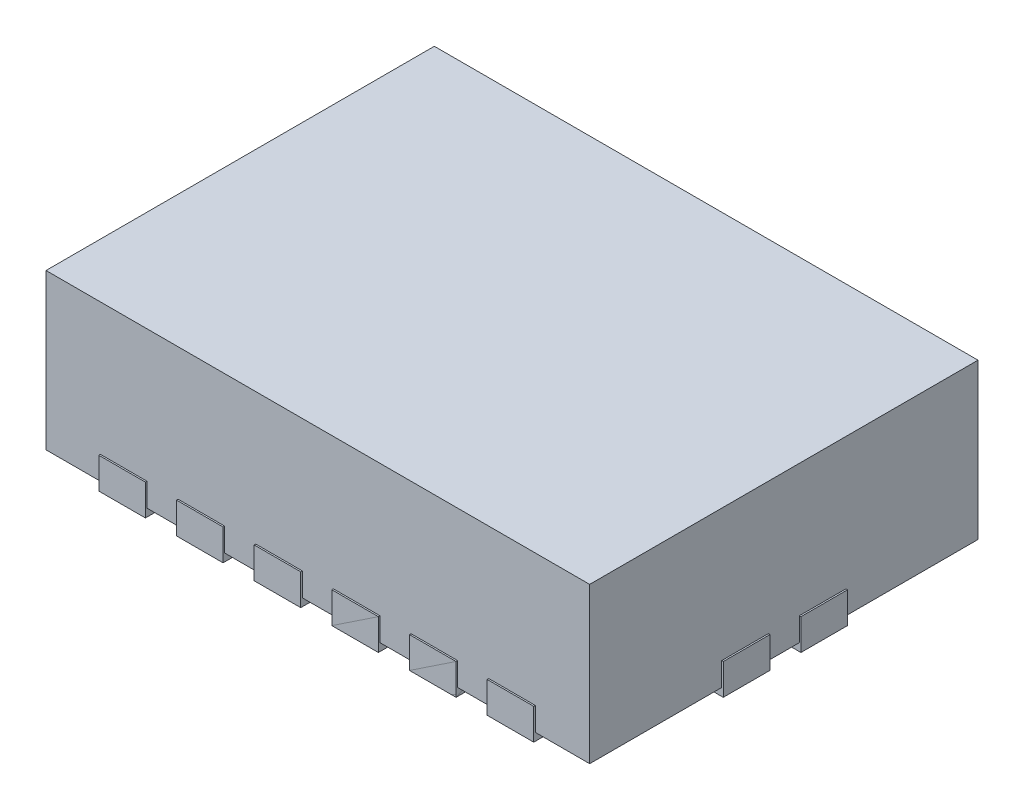
from build123d import *

# Parameters (mm, degrees)
SKETCH1_W            = 3.5
SKETCH1_H            = 2.5
BOSS_EXTRUDE1_DEPTH  = 1
BOSS_EXTRUDE2_START  = 0.05
BOSS_EXTRUDE2_DEPTH  = 0.2
LPATTERN1_START      = -0.05
LPATTERN1_DEPTH      = 0.2
LPATTERN1_2_DEPTH    = 0.2
LPATTERN1_3_DEPTH    = 0.2
LPATTERN1_4_DEPTH    = 0.2
LPATTERN1_5_DEPTH    = 0.2
LPATTERN1_6_DEPTH    = 0.2
LPATTERN1_7_DEPTH    = 0.2
LPATTERN1_8_DEPTH    = 0.2
LPATTERN1_9_DEPTH    = 0.2
LPATTERN1_10_DEPTH   = 0.2
LPATTERN1_11_DEPTH   = 0.2
BOSS_EXTRUDE3_START  = 0.05
BOSS_EXTRUDE3_DEPTH  = 0.2
LPATTERN2_START      = -0.05
LPATTERN2_DEPTH      = 0.2
LPATTERN2_2_DEPTH    = 0.2
LPATTERN2_3_DEPTH    = 0.2
LPATTERN2_4_DEPTH    = 0.2
LPATTERN2_5_DEPTH    = 0.2
LPATTERN2_6_DEPTH    = 0.2
LPATTERN2_7_DEPTH    = 0.2
LPATTERN2_8_DEPTH    = 0.2
LPATTERN2_9_DEPTH    = 0.2
LPATTERN2_10_DEPTH   = 0.2
LPATTERN2_11_DEPTH   = 0.2
BOSS_EXTRUDE4_START  = 0.05
BOSS_EXTRUDE4_DEPTH  = 0.2
LPATTERN3_COUNT      = 2
LPATTERN3_PITCH      = 0.5
MIRROR7_START        = 0.05
MIRROR7_COPY_1_DEPTH = 0.2


# Read off the part's stored shape, not the designer's step: LPattern1, LPattern2
with BuildPart() as part:
    # Sketch1 → Boss-Extrude1 (new body)
    with BuildSketch(Plane(origin=(0, 0, 0), x_dir=(1, 0, 0), z_dir=(0, 1, 0))):
        with Locations((1.75, 1.25)):
            Rectangle(SKETCH1_W, SKETCH1_H)
    extrude(amount=BOSS_EXTRUDE1_DEPTH)


with BuildPart() as body_2:
    # Sketch2 → Boss-Extrude2 (new body)
    with BuildSketch(Plane.XZ.offset(BOSS_EXTRUDE2_START)):
        with BuildLine():
            Line((2.15, 0.01), (2.15, -0.4))
            ThreePointArc((2.15, -0.4), (2, -0.5), (1.85, -0.4))
            Line((1.85, -0.4), (1.85, 0.01))
            Line((1.85, 0.01), (2.15, 0.01))
        make_face()
    extrude(amount=-BOSS_EXTRUDE2_DEPTH)


with BuildPart() as body_3:
    # LPattern1 outline → LPattern1 (new body)
    with BuildSketch(Plane(origin=(0, 0, 0), x_dir=(1, 0, 0), z_dir=(0, 1, 0)).offset(LPATTERN1_START)):
        with BuildLine():
            ThreePointArc((1.65, 0.4), (1.5, 0.5), (1.35, 0.4))
            Line((1.35, 0.4), (1.35, -0.01))
            Line((1.35, -0.01), (1.65, -0.01))
            Line((1.65, -0.01), (1.65, 0.4))
        make_face()
    extrude(amount=LPATTERN1_DEPTH)


with BuildPart() as body_4:
    # LPattern1 2 outline → LPattern1 2 (new body)
    with BuildSketch(Plane(origin=(0, 0, 0), x_dir=(1, 0, 0), z_dir=(0, 1, 0)).offset(LPATTERN1_START)):
        with BuildLine():
            ThreePointArc((2.65, 0.4), (2.5, 0.5), (2.35, 0.4))
            Line((2.35, 0.4), (2.35, -0.01))
            Line((2.35, -0.01), (2.65, -0.01))
            Line((2.65, -0.01), (2.65, 0.4))
        make_face()
    extrude(amount=LPATTERN1_2_DEPTH)


with BuildPart() as body_5:
    # LPattern1 3 outline → LPattern1 3 (new body)
    with BuildSketch(Plane(origin=(0, 0, 0), x_dir=(1, 0, 0), z_dir=(0, 1, 0)).offset(LPATTERN1_START)):
        with BuildLine():
            ThreePointArc((3.15, 0.4), (3, 0.5), (2.85, 0.4))
            Line((2.85, 0.4), (2.85, -0.01))
            Line((2.85, -0.01), (3.15, -0.01))
            Line((3.15, -0.01), (3.15, 0.4))
        make_face()
    extrude(amount=LPATTERN1_3_DEPTH)


with BuildPart() as body_6:
    # LPattern1 4 outline → LPattern1 4 (new body)
    with BuildSketch(Plane(origin=(0, 0, 0), x_dir=(1, 0, 0), z_dir=(0, 1, 0)).offset(LPATTERN1_START)):
        with BuildLine():
            ThreePointArc((1.15, 0.4), (1, 0.5), (0.85, 0.4))
            Line((0.85, 0.4), (0.85, -0.01))
            Line((0.85, -0.01), (1.15, -0.01))
            Line((1.15, -0.01), (1.15, 0.4))
        make_face()
    extrude(amount=LPATTERN1_4_DEPTH)


with BuildPart() as body_7:
    # LPattern1 5 outline → LPattern1 5 (new body)
    with BuildSketch(Plane(origin=(0, 0, 0), x_dir=(1, 0, 0), z_dir=(0, 1, 0)).offset(LPATTERN1_START)):
        with BuildLine():
            ThreePointArc((1.65, 0.4), (1.5, 0.5), (1.35, 0.4))
            Line((1.35, 0.4), (1.35, -0.01))
            Line((1.35, -0.01), (1.65, -0.01))
            Line((1.65, -0.01), (1.65, 0.4))
        make_face()
    extrude(amount=LPATTERN1_5_DEPTH)


with BuildPart() as body_8:
    # LPattern1 6 outline → LPattern1 6 (new body)
    with BuildSketch(Plane(origin=(0, 0, 0), x_dir=(1, 0, 0), z_dir=(0, 1, 0)).offset(LPATTERN1_START)):
        with BuildLine():
            ThreePointArc((2.15, 0.4), (2, 0.5), (1.85, 0.4))
            Line((1.85, 0.4), (1.85, -0.01))
            Line((1.85, -0.01), (2.15, -0.01))
            Line((2.15, -0.01), (2.15, 0.4))
        make_face()
    extrude(amount=LPATTERN1_6_DEPTH)


with BuildPart() as body_9:
    # LPattern1 7 outline → LPattern1 7 (new body)
    with BuildSketch(Plane(origin=(0, 0, 0), x_dir=(1, 0, 0), z_dir=(0, 1, 0)).offset(LPATTERN1_START)):
        with BuildLine():
            ThreePointArc((2.65, 0.4), (2.5, 0.5), (2.35, 0.4))
            Line((2.35, 0.4), (2.35, -0.01))
            Line((2.35, -0.01), (2.65, -0.01))
            Line((2.65, -0.01), (2.65, 0.4))
        make_face()
    extrude(amount=LPATTERN1_7_DEPTH)


with BuildPart() as body_10:
    # LPattern1 8 outline → LPattern1 8 (new body)
    with BuildSketch(Plane(origin=(0, 0, 0), x_dir=(1, 0, 0), z_dir=(0, 1, 0)).offset(LPATTERN1_START)):
        with BuildLine():
            ThreePointArc((0.65, 0.4), (0.5, 0.5), (0.35, 0.4))
            Line((0.35, 0.4), (0.35, -0.01))
            Line((0.35, -0.01), (0.65, -0.01))
            Line((0.65, -0.01), (0.65, 0.4))
        make_face()
    extrude(amount=LPATTERN1_8_DEPTH)


with BuildPart() as body_11:
    # LPattern1 9 outline → LPattern1 9 (new body)
    with BuildSketch(Plane(origin=(0, 0, 0), x_dir=(1, 0, 0), z_dir=(0, 1, 0)).offset(LPATTERN1_START)):
        with BuildLine():
            ThreePointArc((1.15, 0.4), (1, 0.5), (0.85, 0.4))
            Line((0.85, 0.4), (0.85, -0.01))
            Line((0.85, -0.01), (1.15, -0.01))
            Line((1.15, -0.01), (1.15, 0.4))
        make_face()
    extrude(amount=LPATTERN1_9_DEPTH)


with BuildPart() as body_12:
    # LPattern1 10 outline → LPattern1 10 (new body)
    with BuildSketch(Plane(origin=(0, 0, 0), x_dir=(1, 0, 0), z_dir=(0, 1, 0)).offset(LPATTERN1_START)):
        with BuildLine():
            ThreePointArc((1.65, 0.4), (1.5, 0.5), (1.35, 0.4))
            Line((1.35, 0.4), (1.35, -0.01))
            Line((1.35, -0.01), (1.65, -0.01))
            Line((1.65, -0.01), (1.65, 0.4))
        make_face()
    extrude(amount=LPATTERN1_10_DEPTH)


with BuildPart() as body_13:
    # LPattern1 11 outline → LPattern1 11 (new body)
    with BuildSketch(Plane(origin=(0, 0, 0), x_dir=(1, 0, 0), z_dir=(0, 1, 0)).offset(LPATTERN1_START)):
        with BuildLine():
            ThreePointArc((2.15, 0.4), (2, 0.5), (1.85, 0.4))
            Line((1.85, 0.4), (1.85, -0.01))
            Line((1.85, -0.01), (2.15, -0.01))
            Line((2.15, -0.01), (2.15, 0.4))
        make_face()
    extrude(amount=LPATTERN1_11_DEPTH)


with BuildPart() as body_14:
    # Sketch4 → Boss-Extrude3 (new body)
    with BuildSketch(Plane.XZ.offset(BOSS_EXTRUDE3_START)):
        with BuildLine():
            Line((1.35, -2.51), (1.35, -2.1))
            ThreePointArc((1.35, -2.1), (1.5, -2), (1.65, -2.1))
            Line((1.65, -2.1), (1.65, -2.51))
            Line((1.65, -2.51), (1.35, -2.51))
        make_face()
    extrude(amount=-BOSS_EXTRUDE3_DEPTH)


with BuildPart() as body_15:
    # LPattern2 outline → LPattern2 (new body)
    with BuildSketch(Plane(origin=(0, 0, 0), x_dir=(1, 0, 0), z_dir=(0, 1, 0)).offset(LPATTERN2_START)):
        with BuildLine():
            ThreePointArc((1.85, 2.1), (2, 2), (2.15, 2.1))
            Line((2.15, 2.1), (2.15, 2.51))
            Line((2.15, 2.51), (1.85, 2.51))
            Line((1.85, 2.51), (1.85, 2.1))
        make_face()
    extrude(amount=LPATTERN2_DEPTH)


with BuildPart() as body_16:
    # LPattern2 2 outline → LPattern2 2 (new body)
    with BuildSketch(Plane(origin=(0, 0, 0), x_dir=(1, 0, 0), z_dir=(0, 1, 0)).offset(LPATTERN2_START)):
        with BuildLine():
            ThreePointArc((0.85, 2.1), (1, 2), (1.15, 2.1))
            Line((1.15, 2.1), (1.15, 2.51))
            Line((1.15, 2.51), (0.85, 2.51))
            Line((0.85, 2.51), (0.85, 2.1))
        make_face()
    extrude(amount=LPATTERN2_2_DEPTH)


with BuildPart() as body_17:
    # LPattern2 3 outline → LPattern2 3 (new body)
    with BuildSketch(Plane(origin=(0, 0, 0), x_dir=(1, 0, 0), z_dir=(0, 1, 0)).offset(LPATTERN2_START)):
        with BuildLine():
            ThreePointArc((0.35, 2.1), (0.5, 2), (0.65, 2.1))
            Line((0.65, 2.1), (0.65, 2.51))
            Line((0.65, 2.51), (0.35, 2.51))
            Line((0.35, 2.51), (0.35, 2.1))
        make_face()
    extrude(amount=LPATTERN2_3_DEPTH)


with BuildPart() as body_18:
    # LPattern2 4 outline → LPattern2 4 (new body)
    with BuildSketch(Plane(origin=(0, 0, 0), x_dir=(1, 0, 0), z_dir=(0, 1, 0)).offset(LPATTERN2_START)):
        with BuildLine():
            ThreePointArc((2.35, 2.1), (2.5, 2), (2.65, 2.1))
            Line((2.65, 2.1), (2.65, 2.51))
            Line((2.65, 2.51), (2.35, 2.51))
            Line((2.35, 2.51), (2.35, 2.1))
        make_face()
    extrude(amount=LPATTERN2_4_DEPTH)


with BuildPart() as body_19:
    # LPattern2 5 outline → LPattern2 5 (new body)
    with BuildSketch(Plane(origin=(0, 0, 0), x_dir=(1, 0, 0), z_dir=(0, 1, 0)).offset(LPATTERN2_START)):
        with BuildLine():
            ThreePointArc((1.85, 2.1), (2, 2), (2.15, 2.1))
            Line((2.15, 2.1), (2.15, 2.51))
            Line((2.15, 2.51), (1.85, 2.51))
            Line((1.85, 2.51), (1.85, 2.1))
        make_face()
    extrude(amount=LPATTERN2_5_DEPTH)


with BuildPart() as body_20:
    # LPattern2 6 outline → LPattern2 6 (new body)
    with BuildSketch(Plane(origin=(0, 0, 0), x_dir=(1, 0, 0), z_dir=(0, 1, 0)).offset(LPATTERN2_START)):
        with BuildLine():
            ThreePointArc((1.35, 2.1), (1.5, 2), (1.65, 2.1))
            Line((1.65, 2.1), (1.65, 2.51))
            Line((1.65, 2.51), (1.35, 2.51))
            Line((1.35, 2.51), (1.35, 2.1))
        make_face()
    extrude(amount=LPATTERN2_6_DEPTH)


with BuildPart() as body_21:
    # LPattern2 7 outline → LPattern2 7 (new body)
    with BuildSketch(Plane(origin=(0, 0, 0), x_dir=(1, 0, 0), z_dir=(0, 1, 0)).offset(LPATTERN2_START)):
        with BuildLine():
            ThreePointArc((0.85, 2.1), (1, 2), (1.15, 2.1))
            Line((1.15, 2.1), (1.15, 2.51))
            Line((1.15, 2.51), (0.85, 2.51))
            Line((0.85, 2.51), (0.85, 2.1))
        make_face()
    extrude(amount=LPATTERN2_7_DEPTH)


with BuildPart() as body_22:
    # LPattern2 8 outline → LPattern2 8 (new body)
    with BuildSketch(Plane(origin=(0, 0, 0), x_dir=(1, 0, 0), z_dir=(0, 1, 0)).offset(LPATTERN2_START)):
        with BuildLine():
            ThreePointArc((2.85, 2.1), (3, 2), (3.15, 2.1))
            Line((3.15, 2.1), (3.15, 2.51))
            Line((3.15, 2.51), (2.85, 2.51))
            Line((2.85, 2.51), (2.85, 2.1))
        make_face()
    extrude(amount=LPATTERN2_8_DEPTH)


with BuildPart() as body_23:
    # LPattern2 9 outline → LPattern2 9 (new body)
    with BuildSketch(Plane(origin=(0, 0, 0), x_dir=(1, 0, 0), z_dir=(0, 1, 0)).offset(LPATTERN2_START)):
        with BuildLine():
            ThreePointArc((2.35, 2.1), (2.5, 2), (2.65, 2.1))
            Line((2.65, 2.1), (2.65, 2.51))
            Line((2.65, 2.51), (2.35, 2.51))
            Line((2.35, 2.51), (2.35, 2.1))
        make_face()
    extrude(amount=LPATTERN2_9_DEPTH)


with BuildPart() as body_24:
    # LPattern2 10 outline → LPattern2 10 (new body)
    with BuildSketch(Plane(origin=(0, 0, 0), x_dir=(1, 0, 0), z_dir=(0, 1, 0)).offset(LPATTERN2_START)):
        with BuildLine():
            ThreePointArc((1.85, 2.1), (2, 2), (2.15, 2.1))
            Line((2.15, 2.1), (2.15, 2.51))
            Line((2.15, 2.51), (1.85, 2.51))
            Line((1.85, 2.51), (1.85, 2.1))
        make_face()
    extrude(amount=LPATTERN2_10_DEPTH)


with BuildPart() as body_25:
    # LPattern2 11 outline → LPattern2 11 (new body)
    with BuildSketch(Plane(origin=(0, 0, 0), x_dir=(1, 0, 0), z_dir=(0, 1, 0)).offset(LPATTERN2_START)):
        with BuildLine():
            ThreePointArc((1.35, 2.1), (1.5, 2), (1.65, 2.1))
            Line((1.65, 2.1), (1.65, 2.51))
            Line((1.65, 2.51), (1.35, 2.51))
            Line((1.35, 2.51), (1.35, 2.1))
        make_face()
    extrude(amount=LPATTERN2_11_DEPTH)


with BuildPart() as body_26:
    # Sketch5 → Boss-Extrude4 (new body)
    with BuildSketch(Plane.XZ.offset(BOSS_EXTRUDE4_START)):
        with BuildLine():
            Line((-0.01, -0.85), (0.4, -0.85))
            ThreePointArc((0.4, -0.85), (0.5, -1), (0.4, -1.15))
            Line((0.4, -1.15), (-0.01, -1.15))
            Line((-0.01, -1.15), (-0.01, -0.85))
        make_face()
    boss_extrude4 = extrude(amount=-BOSS_EXTRUDE4_DEPTH)


with BuildPart() as lpattern3_1:
    # LPattern3: Boss-Extrude4 ×2
    with Locations(*[(0, 0, -i * LPATTERN3_PITCH) for i in range(1, LPATTERN3_COUNT)]):
        add(boss_extrude4)


with BuildPart() as part_1:
    add(part.part)

    # Mirror7: Boss-Extrude4 across plane
    add(boss_extrude4.mirror(Plane(origin=(1.75, 0, 0), x_dir=(0, 0, 1), z_dir=(1, 0, 0))))

    # Mirror7 copy 1 sketch → Mirror7 copy 1 (add)
    with BuildSketch(Plane(origin=(3.5, 0, -0.5), x_dir=(-1, 0, 0), z_dir=(0, -1, 0)).offset(MIRROR7_START)):
        with BuildLine():
            Line((-0.01, 0.85), (0.4, 0.85))
            ThreePointArc((0.4, 0.85), (0.5, 1), (0.4, 1.15))
            Line((0.4, 1.15), (-0.01, 1.15))
            Line((-0.01, 1.15), (-0.01, 0.85))
        make_face()
    extrude(amount=-MIRROR7_COPY_1_DEPTH)


solid = Compound([body_2.part, body_3.part, body_4.part, body_5.part, body_6.part, body_7.part, body_8.part, body_9.part, body_10.part, body_11.part, body_12.part, body_13.part, body_14.part, body_15.part, body_16.part, body_17.part, body_18.part, body_19.part, body_20.part, body_21.part, body_22.part, body_23.part, body_24.part, body_25.part, body_26.part, lpattern3_1.part, part_1.part])
